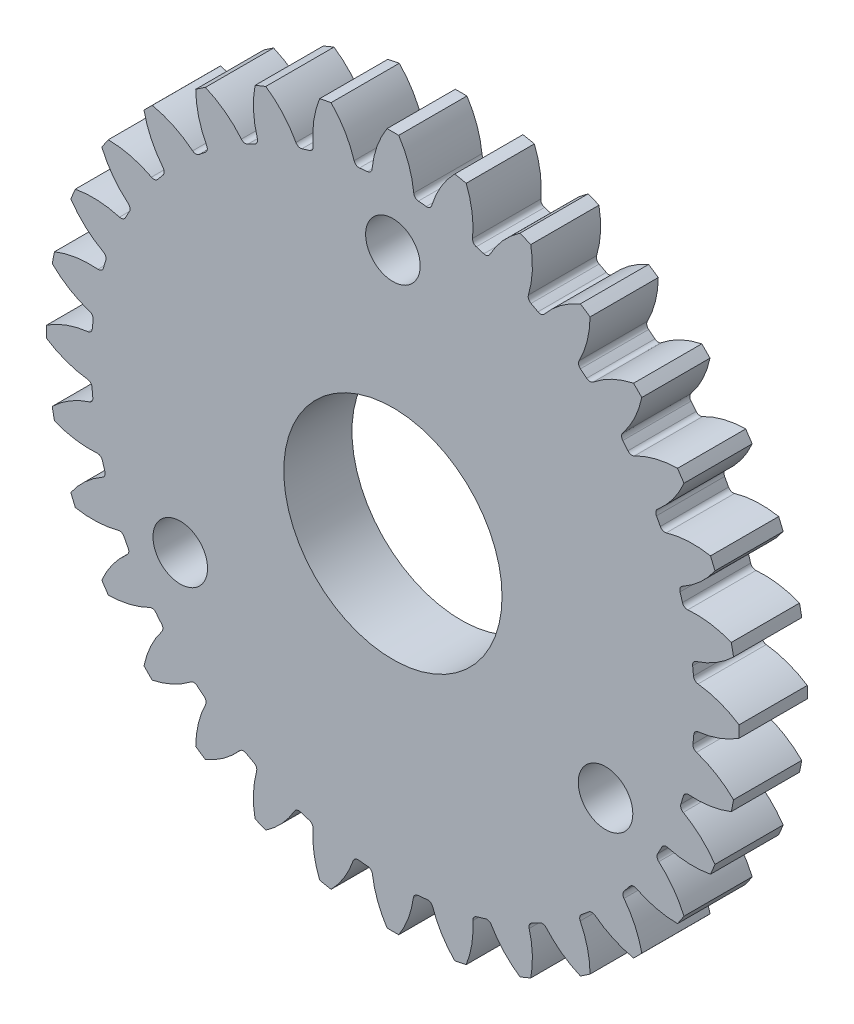
from build123d import *

# Parameters (mm, degrees)
SKETCH_1_R               = 22.125
EXTRUDE_1_DEPTH          = 5
EXTRUDE_2_DEPTH          = 5
FILLET_1_R               = 0.375
PATTERN_CIRCULAR_1_DEPTH = 5
CUT_EXTRUDE_1_REACH      = 38.324
SKETCH_2_R               = 8
SKETCH_2_R_2             = 2
PATTERN_CIRCULAR_2_COUNT = 3


# Read off the part's stored shape, not the designer's step: 원형 패턴1
with BuildPart() as part:
    # 스케치1 → 보스-돌출1 (new body)
    with BuildSketch(Plane.XY):
        Circle(SKETCH_1_R)
    extrude(amount=EXTRUDE_1_DEPTH)

    # 스케치1<3> → 보스-돌출2 (add)
    with BuildSketch(Plane.XY):
        with BuildLine():
            ThreePointArc((1.5525, 22.070463719), (1.21585383, 23.857604943), (0.4275, 25.496416292))
            ThreePointArc((0.4275, 25.496416292), (0, 25.5), (-0.4275, 25.496416292))
            ThreePointArc((-0.4275, 25.496416292), (-1.21585383, 23.857604943), (-1.5525, 22.070463719))
            ThreePointArc((-1.5525, 22.070463719), (0, 22.125), (1.5525, 22.070463719))
        make_face()
    extrude(amount=EXTRUDE_2_DEPTH)

    # 필렛1
    fillet_1_edges = [part.edges().sort_by_distance(p)[0] for p in [
        (-1.5525, 22.070463719, 2.5),
        (1.5525, 22.070463719, 2.5),
    ]]
    fillet(fillet_1_edges, radius=FILLET_1_R)

    # 원형 패턴1 outline → 원형 패턴1 (add)
    with BuildSketch(Plane.XY):
        with BuildLine():
            ThreePointArc((2.444283435, 21.98956806), (4.293588924, 21.704394005), (6.112184567, 21.263979515))
            ThreePointArc((6.112184567, 21.263979515), (5.905769655, 21.413393015), (5.842497848, 21.660229374))
            ThreePointArc((5.842497848, 21.660229374), (5.802654343, 23.32123269), (5.370053117, 24.92540715))
            ThreePointArc((5.370053117, 24.92540715), (4.951466557, 25.01232311), (4.531481703, 25.092209375))
            ThreePointArc((4.531481703, 25.092209375), (3.516946773, 23.774058474), (2.84435724, 22.252734629))
            ThreePointArc((2.84435724, 22.252734629), (2.691796357, 22.048976858), (2.444283435, 21.98956806))
        make_face()
        with BuildLine():
            ThreePointArc((6.666619461, 21.0967251), (8.424754042, 20.458229257), (10.122674393, 19.673512349))
            ThreePointArc((10.122674393, 19.673512349), (9.949192224, 19.860116616), (9.934998054, 20.114509502))
            ThreePointArc((9.934998054, 20.114509502), (10.217786423, 21.747544593), (10.106238105, 23.401125508))
            ThreePointArc((10.106238105, 23.401125508), (9.712651031, 23.56803359), (9.316321105, 23.728319843))
            ThreePointArc((9.316321105, 23.728319843), (8.065688244, 22.635164018), (7.109877676, 21.276672808))
            ThreePointArc((7.109877676, 21.276672808), (6.920669662, 21.106837331), (6.666619461, 21.0967251))
        make_face()
        with BuildLine():
            ThreePointArc((10.637215679, 19.400135762), (12.236924822, 18.432940512), (13.749277459, 17.334156869))
            ThreePointArc((13.749277459, 17.334156869), (13.615350812, 17.550745341), (13.650644172, 17.802938306))
            ThreePointArc((13.650644172, 17.802938306), (14.242359023, 19.344526043), (14.45404603, 20.982148657))
            ThreePointArc((14.45404603, 20.982148657), (14.100583772, 21.222634676), (13.743139511, 21.457161206))
            ThreePointArc((13.743139511, 21.457161206), (12.306838953, 20.631658701), (11.106467915, 19.489939361))
            ThreePointArc((11.106467915, 19.489939361), (10.887994282, 19.360635713), (10.637215679, 19.400135762))
        make_face()
        with BuildLine():
            ThreePointArc((14.204936343, 16.962765355), (15.585070274, 15.704178092), (16.854128337, 14.33366607))
            ThreePointArc((16.854128337, 14.33366607), (16.764821309, 14.571883643), (16.848096194, 14.812276344))
            ThreePointArc((16.848096194, 14.812276344), (17.72266337, 16.203684458), (18.246393072, 17.76143652))
            ThreePointArc((18.246393072, 17.76143652), (17.946638987, 18.066258733), (17.641816774, 18.366012818))
            ThreePointArc((17.641816774, 18.366012818), (16.077838182, 17.839327127), (14.681942355, 16.959042118))
            ThreePointArc((14.681942355, 16.959042118), (14.442771029, 16.875281275), (14.204936343, 16.962765355))
        make_face()
        with BuildLine():
            ThreePointArc((17.23316378, 13.875651017), (18.341049205, 12.374228826), (19.318483962, 10.784794963))
            ThreePointArc((19.318483962, 10.784794963), (19.277111642, 11.035473468), (19.405032293, 11.254990413))
            ThreePointArc((19.405032293, 11.254990413), (20.525515383, 12.444582496), (21.337541461, 13.862759257))
            ThreePointArc((21.337541461, 13.862759257), (21.10301493, 14.220203518), (20.862528911, 14.573665776))
            ThreePointArc((20.862528911, 14.573665776), (19.233698347, 14.364194467), (17.699368241, 13.778704622))
            ThreePointArc((17.699368241, 13.778704622), (17.448903967, 13.74368568), (17.23316378, 13.875651017))
        make_face()
        with BuildLine():
            ThreePointArc((19.604964477, 10.254803403), (20.398452702, 8.568474331), (21.047204906, 6.821348154))
            ThreePointArc((21.047204906, 6.821348154), (21.055215407, 7.07487041), (21.222770502, 7.265298855))
            ThreePointArc((21.222770502, 7.265298855), (22.54328999, 8.210414093), (23.608700097, 9.43594085))
            ThreePointArc((23.608700097, 9.43594085), (23.448413844, 9.832270776), (23.281505763, 10.225857851))
            ThreePointArc((23.281505763, 10.225857851), (21.652584428, 10.338647109), (20.042246813, 10.068612114))
            ThreePointArc((20.042246813, 10.068612114), (19.790342871, 10.083587973), (19.604964477, 10.254803403))
        make_face()
        with BuildLine():
            ThreePointArc((21.227659819, 6.237153486), (21.676765844, 4.430964629), (21.972478136, 2.59342044))
            ThreePointArc((21.972478136, 2.59342044), (22.029410154, 2.840097121), (22.230125273, 2.994382832))
            ThreePointArc((22.230125273, 2.994382832), (23.698043896, 3.662691346), (24.972589629, 4.651101448))
            ThreePointArc((24.972589629, 4.651101448), (24.892703364, 5.071086302), (24.805787404, 5.489672863))
            ThreePointArc((24.805787404, 5.489672863), (23.240578184, 5.916523463), (21.619064629, 5.969202918))
            ThreePointArc((21.619064629, 5.969202918), (21.375614895, 6.033432001), (21.227659819, 6.237153486))
        make_face()
        with BuildLine():
            ThreePointArc((22.036616892, 1.975636845), (22.124678801, 0.119218153), (22.056627935, -1.738041748))
            ThreePointArc((22.056627935, -1.738041748), (22.160143507, -1.507598022), (22.386340823, -1.395105539))
            ThreePointArc((22.386340823, -1.395105539), (23.944570362, -1.024781477), (25.376796547, -0.307880254))
            ThreePointArc((25.376796547, -0.307880254), (25.380380254, 0.119619746), (25.376796547, 0.547119746))
            ThreePointArc((25.376796547, 0.547119746), (23.935432495, 1.267335951), (22.36703156, 1.636605795))
            ThreePointArc((22.36703156, 1.636605795), (22.141563156, 1.747391769), (22.036616892, 1.975636845))
        make_face()
        with BuildLine():
            ThreePointArc((21.998080207, -2.366451395), (21.722388331, -4.201603288), (21.29387741, -6.007196506))
            ThreePointArc((21.29387741, -6.007196506), (21.439866375, -5.801714546), (21.682959992, -5.735072913))
            ThreePointArc((21.682959992, -5.735072913), (23.272260054, -5.672441899), (24.805787404, -5.250433372))
            ThreePointArc((24.805787404, -5.250433372), (24.892703364, -4.831846811), (24.972589629, -4.411861957))
            ThreePointArc((24.972589629, -4.411861957), (23.709149885, -3.43017512), (22.254829489, -2.763135975))
            ThreePointArc((22.254829489, -2.763135975), (22.056115926, -2.610319699), (21.998080207, -2.366451395))
        make_face()
        with BuildLine():
            ThreePointArc((21.110882023, -6.621652755), (20.482752043, -8.364956291), (19.71094801, -10.049584745))
            ThreePointArc((19.71094801, -10.049584745), (19.893697953, -9.87680877), (20.14451354, -9.858352866))
            ThreePointArc((20.14451354, -9.858352866), (21.705678583, -10.101781735), (23.281505763, -9.986618359))
            ThreePointArc((23.281505763, -9.986618359), (23.448413844, -9.593031285), (23.608700097, -9.196701359))
            ThreePointArc((23.608700097, -9.196701359), (22.569257668, -7.994919475), (21.284214484, -7.060369168))
            ThreePointArc((21.284214484, -7.060369168), (21.119927454, -6.871678162), (21.110882023, -6.621652755))
        make_face()
        with BuildLine():
            ThreePointArc((19.406900344, -10.62486913), (18.451191556, -12.209387993), (17.366419791, -13.708504245))
            ThreePointArc((17.366419791, -13.708504245), (17.578843089, -13.574909628), (17.827951011, -13.605182093))
            ThreePointArc((17.827951011, -13.605182093), (19.303813682, -14.142189891), (20.862528911, -14.334426284))
            ThreePointArc((20.862528911, -14.334426284), (21.10301493, -13.980964026), (21.337541461, -13.623519766))
            ThreePointArc((21.337541461, -13.623519766), (20.558699666, -12.250501719), (19.490347943, -11.088435587))
            ThreePointArc((19.490347943, -11.088435587), (19.366762894, -10.871388379), (19.406900344, -10.62486913))
        make_face()
        with BuildLine():
            ThreePointArc((16.950180728, -14.219950714), (15.704287436, -15.584960094), (14.348820513, -16.841228426))
            ThreePointArc((14.348820513, -16.841228426), (14.582728556, -16.751788122), (14.820780557, -16.829529911))
            ThreePointArc((14.820780557, -16.829529911), (16.15799263, -17.637565788), (17.641816774, -18.126773326))
            ThreePointArc((17.641816774, -18.126773326), (17.946638987, -17.827019241), (18.246393072, -17.522197028))
            ThreePointArc((18.246393072, -17.522197028), (17.754320073, -16.032149616), (16.940780061, -14.690311409))
            ThreePointArc((16.940780061, -14.690311409), (16.8625468, -14.453473544), (16.950180728, -14.219950714))
        make_face()
        with BuildLine():
            ThreePointArc((13.8346996, -17.266056642), (12.347067062, -18.359345303), (10.773466099, -19.324804093))
            ThreePointArc((10.773466099, -19.324804093), (11.019879813, -19.282812425), (11.23794008, -19.405012011))
            ThreePointArc((11.23794008, -19.405012011), (12.388522161, -20.452441629), (13.743139511, -21.217921715))
            ThreePointArc((13.743139511, -21.217921715), (14.100583772, -20.983395184), (14.45404603, -20.742909166))
            ThreePointArc((14.45404603, -20.742909166), (14.263976267, -19.193236454), (13.733070589, -17.724988794))
            ThreePointArc((13.733070589, -17.724988794), (13.703055858, -17.47762335), (13.8346996, -17.266056642))
        make_face()
        with BuildLine():
            ThreePointArc((10.180818838, -19.643486269), (8.509053227, -20.423311146), (6.778135903, -21.061160905))
            ThreePointArc((6.778135903, -21.061160905), (7.027621197, -21.068119163), (7.217483275, -21.230118301))
            ThreePointArc((7.217483275, -21.230118301), (8.140156862, -22.477360442), (9.316321105, -23.489080352))
            ThreePointArc((9.316321105, -23.489080352), (9.712651031, -23.328794099), (10.106238105, -23.161886017))
            ThreePointArc((10.106238105, -23.161886017), (10.222380819, -21.611116982), (9.991103394, -20.07329889))
            ThreePointArc((9.991103394, -20.07329889), (10.010308106, -19.825000018), (10.180818838, -19.643486269))
        make_face()
        with BuildLine():
            ThreePointArc((6.130557784, -21.258689665), (4.339211302, -21.695319087), (2.517730048, -21.981279772))
            ThreePointArc((2.517730048, -21.981279772), (2.760746743, -22.036846106), (2.915228107, -22.232499471))
            ThreePointArc((2.915228107, -22.232499471), (3.57655537, -23.633277687), (4.531481703, -24.852969884))
            ThreePointArc((4.531481703, -24.852969884), (4.951466557, -24.773083619), (5.370053117, -24.686167658))
            ThreePointArc((5.370053117, -24.686167658), (5.785834439, -23.192020923), (5.860226722, -21.642887501))
            ThreePointArc((5.860226722, -21.642887501), (5.927776723, -21.40321263), (6.130557784, -21.258689665))
        make_face()
        with BuildLine():
            ThreePointArc((1.841881972, -22.048199378), (0, -22.125), (-1.841881972, -22.048199378))
            ThreePointArc((-1.841881972, -22.048199378), (-1.614629067, -22.150203696), (-1.50142289, -22.372089084))
            ThreePointArc((-1.50142289, -22.372089084), (-1.126066567, -23.874787592), (-0.4275, -25.257176801))
            ThreePointArc((-0.4275, -25.257176801), (0, -25.260760509), (0.4275, -25.257176801))
            ThreePointArc((0.4275, -25.257176801), (1.126066567, -23.874787592), (1.50142289, -22.372089084))
            ThreePointArc((1.50142289, -22.372089084), (1.614629067, -22.150203696), (1.841881972, -22.048199378))
        make_face()
        with BuildLine():
            ThreePointArc((-2.517730048, -21.981279772), (-4.339211302, -21.695319087), (-6.130557784, -21.258689665))
            ThreePointArc((-6.130557784, -21.258689665), (-5.927776723, -21.40321263), (-5.860226722, -21.642887501))
            ThreePointArc((-5.860226722, -21.642887501), (-5.785834439, -23.192020923), (-5.370053117, -24.686167658))
            ThreePointArc((-5.370053117, -24.686167658), (-4.951466557, -24.773083619), (-4.531481703, -24.852969884))
            ThreePointArc((-4.531481703, -24.852969884), (-3.57655537, -23.633277687), (-2.915228107, -22.232499471))
            ThreePointArc((-2.915228107, -22.232499471), (-2.760746743, -22.036846106), (-2.517730048, -21.981279772))
        make_face()
        with BuildLine():
            ThreePointArc((-6.778135903, -21.061160905), (-8.509053227, -20.423311146), (-10.180818838, -19.643486269))
            ThreePointArc((-10.180818838, -19.643486269), (-10.010308106, -19.825000018), (-9.991103394, -20.07329889))
            ThreePointArc((-9.991103394, -20.07329889), (-10.222380819, -21.611116982), (-10.106238105, -23.161886017))
            ThreePointArc((-10.106238105, -23.161886017), (-9.712651031, -23.328794099), (-9.316321105, -23.489080352))
            ThreePointArc((-9.316321105, -23.489080352), (-8.140156862, -22.477360442), (-7.217483275, -21.230118301))
            ThreePointArc((-7.217483275, -21.230118301), (-7.027621197, -21.068119163), (-6.778135903, -21.061160905))
        make_face()
        with BuildLine():
            ThreePointArc((-10.773466099, -19.324804093), (-12.347067062, -18.359345303), (-13.8346996, -17.266056642))
            ThreePointArc((-13.8346996, -17.266056642), (-13.703055858, -17.47762335), (-13.733070589, -17.724988794))
            ThreePointArc((-13.733070589, -17.724988794), (-14.263976267, -19.193236454), (-14.45404603, -20.742909166))
            ThreePointArc((-14.45404603, -20.742909166), (-14.100583772, -20.983395184), (-13.743139511, -21.217921715))
            ThreePointArc((-13.743139511, -21.217921715), (-12.388522161, -20.452441629), (-11.23794008, -19.405012011))
            ThreePointArc((-11.23794008, -19.405012011), (-11.019879813, -19.282812425), (-10.773466099, -19.324804093))
        make_face()
        with BuildLine():
            ThreePointArc((-14.348820513, -16.841228426), (-15.704287436, -15.584960094), (-16.950180728, -14.219950714))
            ThreePointArc((-16.950180728, -14.219950714), (-16.8625468, -14.453473544), (-16.940780061, -14.690311409))
            ThreePointArc((-16.940780061, -14.690311409), (-17.754320073, -16.032149616), (-18.246393072, -17.522197028))
            ThreePointArc((-18.246393072, -17.522197028), (-17.946638987, -17.827019241), (-17.641816774, -18.126773326))
            ThreePointArc((-17.641816774, -18.126773326), (-16.15799263, -17.637565788), (-14.820780557, -16.829529911))
            ThreePointArc((-14.820780557, -16.829529911), (-14.582728556, -16.751788122), (-14.348820513, -16.841228426))
        make_face()
        with BuildLine():
            ThreePointArc((-17.366419791, -13.708504245), (-18.451191556, -12.209387993), (-19.406900344, -10.62486913))
            ThreePointArc((-19.406900344, -10.62486913), (-19.366762894, -10.871388379), (-19.490347943, -11.088435587))
            ThreePointArc((-19.490347943, -11.088435587), (-20.558699666, -12.250501719), (-21.337541461, -13.623519766))
            ThreePointArc((-21.337541461, -13.623519766), (-21.10301493, -13.980964026), (-20.862528911, -14.334426284))
            ThreePointArc((-20.862528911, -14.334426284), (-19.303813682, -14.142189891), (-17.827951011, -13.605182093))
            ThreePointArc((-17.827951011, -13.605182093), (-17.578843089, -13.574909628), (-17.366419791, -13.708504245))
        make_face()
        with BuildLine():
            ThreePointArc((-19.71094801, -10.049584745), (-20.482752043, -8.364956291), (-21.110882023, -6.621652755))
            ThreePointArc((-21.110882023, -6.621652755), (-21.119927454, -6.871678162), (-21.284214484, -7.060369168))
            ThreePointArc((-21.284214484, -7.060369168), (-22.569257668, -7.994919475), (-23.608700097, -9.196701359))
            ThreePointArc((-23.608700097, -9.196701359), (-23.448413844, -9.593031285), (-23.281505763, -9.986618359))
            ThreePointArc((-23.281505763, -9.986618359), (-21.705678583, -10.101781735), (-20.14451354, -9.858352866))
            ThreePointArc((-20.14451354, -9.858352866), (-19.893697953, -9.87680877), (-19.71094801, -10.049584745))
        make_face()
        with BuildLine():
            ThreePointArc((-21.29387741, -6.007196506), (-21.722388331, -4.201603288), (-21.998080207, -2.366451395))
            ThreePointArc((-21.998080207, -2.366451395), (-22.056115926, -2.610319699), (-22.254829489, -2.763135975))
            ThreePointArc((-22.254829489, -2.763135975), (-23.709149885, -3.43017512), (-24.972589629, -4.411861957))
            ThreePointArc((-24.972589629, -4.411861957), (-24.892703364, -4.831846811), (-24.805787404, -5.250433372))
            ThreePointArc((-24.805787404, -5.250433372), (-23.272260054, -5.672441899), (-21.682959992, -5.735072913))
            ThreePointArc((-21.682959992, -5.735072913), (-21.439866375, -5.801714546), (-21.29387741, -6.007196506))
        make_face()
        with BuildLine():
            ThreePointArc((-22.056627935, -1.738041748), (-22.124678801, 0.119218153), (-22.036616892, 1.975636845))
            ThreePointArc((-22.036616892, 1.975636845), (-22.141563156, 1.747391769), (-22.36703156, 1.636605795))
            ThreePointArc((-22.36703156, 1.636605795), (-23.935432495, 1.267335951), (-25.376796547, 0.547119746))
            ThreePointArc((-25.376796547, 0.547119746), (-25.380380254, 0.119619746), (-25.376796547, -0.307880254))
            ThreePointArc((-25.376796547, -0.307880254), (-23.944570362, -1.024781477), (-22.386340823, -1.395105539))
            ThreePointArc((-22.386340823, -1.395105539), (-22.160143507, -1.507598022), (-22.056627935, -1.738041748))
        make_face()
        with BuildLine():
            ThreePointArc((-21.972478136, 2.59342044), (-21.676765844, 4.430964629), (-21.227659819, 6.237153486))
            ThreePointArc((-21.227659819, 6.237153486), (-21.375614895, 6.033432001), (-21.619064629, 5.969202918))
            ThreePointArc((-21.619064629, 5.969202918), (-23.240578184, 5.916523463), (-24.805787404, 5.489672863))
            ThreePointArc((-24.805787404, 5.489672863), (-24.892703364, 5.071086302), (-24.972589629, 4.651101448))
            ThreePointArc((-24.972589629, 4.651101448), (-23.698043896, 3.662691346), (-22.230125273, 2.994382832))
            ThreePointArc((-22.230125273, 2.994382832), (-22.029410154, 2.840097121), (-21.972478136, 2.59342044))
        make_face()
        with BuildLine():
            ThreePointArc((-21.047204906, 6.821348154), (-20.398452702, 8.568474331), (-19.604964477, 10.254803403))
            ThreePointArc((-19.604964477, 10.254803403), (-19.790342871, 10.083587973), (-20.042246813, 10.068612114))
            ThreePointArc((-20.042246813, 10.068612114), (-21.652584428, 10.338647109), (-23.281505763, 10.225857851))
            ThreePointArc((-23.281505763, 10.225857851), (-23.448413844, 9.832270776), (-23.608700097, 9.43594085))
            ThreePointArc((-23.608700097, 9.43594085), (-22.54328999, 8.210414093), (-21.222770502, 7.265298855))
            ThreePointArc((-21.222770502, 7.265298855), (-21.055215407, 7.07487041), (-21.047204906, 6.821348154))
        make_face()
        with BuildLine():
            ThreePointArc((-19.318483962, 10.784794963), (-18.341049205, 12.374228826), (-17.23316378, 13.875651017))
            ThreePointArc((-17.23316378, 13.875651017), (-17.448903967, 13.74368568), (-17.699368241, 13.778704622))
            ThreePointArc((-17.699368241, 13.778704622), (-19.233698347, 14.364194467), (-20.862528911, 14.573665776))
            ThreePointArc((-20.862528911, 14.573665776), (-21.10301493, 14.220203518), (-21.337541461, 13.862759257))
            ThreePointArc((-21.337541461, 13.862759257), (-20.525515383, 12.444582496), (-19.405032293, 11.254990413))
            ThreePointArc((-19.405032293, 11.254990413), (-19.277111642, 11.035473468), (-19.318483962, 10.784794963))
        make_face()
        with BuildLine():
            ThreePointArc((-16.854128337, 14.33366607), (-15.585070274, 15.704178092), (-14.204936343, 16.962765355))
            ThreePointArc((-14.204936343, 16.962765355), (-14.442771029, 16.875281275), (-14.681942355, 16.959042118))
            ThreePointArc((-14.681942355, 16.959042118), (-16.077838182, 17.839327127), (-17.641816774, 18.366012818))
            ThreePointArc((-17.641816774, 18.366012818), (-17.946638987, 18.066258733), (-18.246393072, 17.76143652))
            ThreePointArc((-18.246393072, 17.76143652), (-17.72266337, 16.203684458), (-16.848096194, 14.812276344))
            ThreePointArc((-16.848096194, 14.812276344), (-16.764821309, 14.571883643), (-16.854128337, 14.33366607))
        make_face()
        with BuildLine():
            ThreePointArc((-13.749277459, 17.334156869), (-12.236924822, 18.432940512), (-10.637215679, 19.400135762))
            ThreePointArc((-10.637215679, 19.400135762), (-10.887994282, 19.360635713), (-11.106467915, 19.489939361))
            ThreePointArc((-11.106467915, 19.489939361), (-12.306838953, 20.631658701), (-13.743139511, 21.457161206))
            ThreePointArc((-13.743139511, 21.457161206), (-14.100583772, 21.222634676), (-14.45404603, 20.982148657))
            ThreePointArc((-14.45404603, 20.982148657), (-14.242359023, 19.344526043), (-13.650644172, 17.802938306))
            ThreePointArc((-13.650644172, 17.802938306), (-13.615350812, 17.550745341), (-13.749277459, 17.334156869))
        make_face()
        with BuildLine():
            ThreePointArc((-10.122674393, 19.673512349), (-8.424754042, 20.458229257), (-6.666619461, 21.0967251))
            ThreePointArc((-6.666619461, 21.0967251), (-6.920669662, 21.106837331), (-7.109877676, 21.276672808))
            ThreePointArc((-7.109877676, 21.276672808), (-8.065688244, 22.635164018), (-9.316321105, 23.728319843))
            ThreePointArc((-9.316321105, 23.728319843), (-9.712651031, 23.56803359), (-10.106238105, 23.401125508))
            ThreePointArc((-10.106238105, 23.401125508), (-10.217786423, 21.747544593), (-9.934998054, 20.114509502))
            ThreePointArc((-9.934998054, 20.114509502), (-9.949192224, 19.860116616), (-10.122674393, 19.673512349))
        make_face()
        with BuildLine():
            ThreePointArc((-2.84435724, 22.252734629), (-3.516946773, 23.774058474), (-4.531481703, 25.092209375))
            ThreePointArc((-4.531481703, 25.092209375), (-4.951466557, 25.01232311), (-5.370053117, 24.92540715))
            ThreePointArc((-5.370053117, 24.92540715), (-5.802654343, 23.32123269), (-5.842497848, 21.660229374))
            ThreePointArc((-5.842497848, 21.660229374), (-5.905769655, 21.413393015), (-6.112184567, 21.263979515))
            ThreePointArc((-6.112184567, 21.263979515), (-4.293588924, 21.704394005), (-2.444283435, 21.98956806))
            ThreePointArc((-2.444283435, 21.98956806), (-2.691796357, 22.048976858), (-2.84435724, 22.252734629))
        make_face()
    extrude(amount=PATTERN_CIRCULAR_1_DEPTH)

    # 스케치2 → 컷-돌출1 (cut, up to next)
    with BuildSketch(Plane.XY.offset(5), mode=Mode.PRIVATE) as cut_extrude_1_sk1:
        Circle(SKETCH_2_R)
    cut_extrude_1_tool1 = extrude(cut_extrude_1_sk1.sketch, amount=-CUT_EXTRUDE_1_REACH, mode=Mode.PRIVATE) & part.part
    # 스케치2 → 컷-돌출1 (cut, up to next)
    with BuildSketch(Plane.XY.offset(5), mode=Mode.PRIVATE) as cut_extrude_1_sk2:
        with Locations((0, 18)):
            Circle(SKETCH_2_R_2)
    cut_extrude_1_tool2 = extrude(cut_extrude_1_sk2.sketch, amount=-CUT_EXTRUDE_1_REACH, mode=Mode.PRIVATE) & part.part
    cut_extrude_1_1 = cut_extrude_1_tool1.solids().sort_by_distance((0, 0, 5))[0]
    add(cut_extrude_1_1, mode=Mode.SUBTRACT)
    cut_extrude_1_2 = cut_extrude_1_tool2.solids().sort_by_distance((0, 18, 5))[0]
    add(cut_extrude_1_2, mode=Mode.SUBTRACT)
    cut_extrude_1 = cut_extrude_1_1 + cut_extrude_1_2  # 컷-돌출1 as one shape, for the pattern or mirror that repeats it

    # 원형 패턴2: 컷-돌출1 ×3 about axis
    pattern_circular_2_axis = Axis((0, 0, 0), (0, 0, 1))
    for i in range(1, PATTERN_CIRCULAR_2_COUNT):
        add(cut_extrude_1.rotate(pattern_circular_2_axis, i * 360 / PATTERN_CIRCULAR_2_COUNT), mode=Mode.SUBTRACT)


solid = part.part
